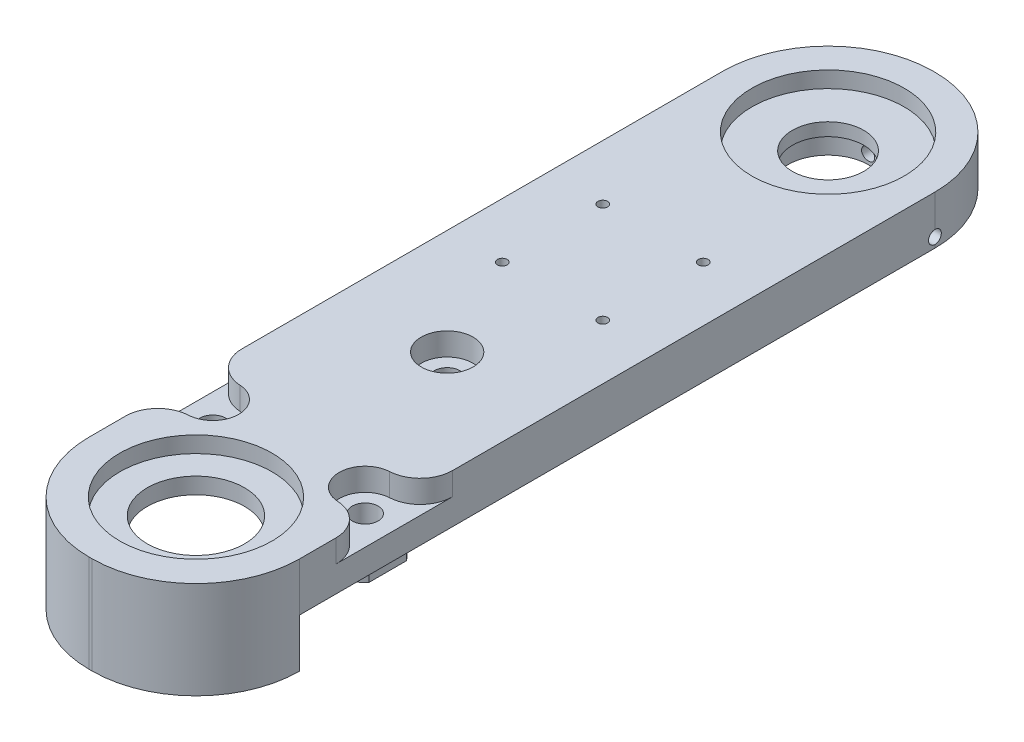
from build123d import *

# Parameters (mm, degrees)
BOSS_EXTRUDE1_DEPTH = 15
SKETCH2_R           = 23.5
CUT_EXTRUDE1_DEPTH  = 5
SKETCH3_R           = 11
CUT_EXTRUDE2_DEPTH  = 135.373546504
SKETCH17_R          = 23.5
CUT_EXTRUDE10_DEPTH = 5
SKETCH18_R          = 15
CUT_EXTRUDE11_DEPTH = 135.373546504
CUT_EXTRUDE12_START = -5
SKETCH19_R          = 23.5
CUT_EXTRUDE12_DEPTH = 5
CUT_EXTRUDE13_DEPTH = 10
SKETCH21_R          = 1.5
CUT_EXTRUDE14_DEPTH = 135.373546504
SKETCH22_R          = 8
CUT_EXTRUDE15_DEPTH = 4
SKETCH23_R          = 4
BOSS_EXTRUDE6_DEPTH = 4
SKETCH24_R          = 4
CUT_EXTRUDE16_DEPTH = 135.837865602
BOSS_EXTRUDE8_START = 15
BOSS_EXTRUDE8_DEPTH = 15
SKETCH28_R          = 8
CUT_EXTRUDE17_DEPTH = 7
FILLET1_R           = 10
SKETCH29_R          = 12.5
CUT_EXTRUDE18_DEPTH = 6
SKETCH30_R          = 2
CUT_EXTRUDE19_DEPTH = 25
SKETCH32_R          = 2
CUT_EXTRUDE20_DEPTH = 25


with BuildPart() as part:
    # Sketch1 → Boss-Extrude1 (new body)
    with BuildSketch(Plane(origin=(0, 0, 0), x_dir=(1, 0, 0), z_dir=(0, 1, 0))):
        with BuildLine():
            Line((0, 130), (0.5, 130))
            ThreePointArc((0.5, 130), (23.127416998, 120.627416998), (32.5, 98))
            Line((32.5, 98), (32.5, -98))
            ThreePointArc((32.5, -98), (23.127416998, -120.627416998), (0.5, -130))
            Line((0.5, -130), (-0.5, -130))
            ThreePointArc((-0.5, -130), (-23.127416998, -120.627416998), (-32.5, -98))
            Line((-32.5, -98), (-32.5, 97.5))
            ThreePointArc((-32.5, 97.5), (-22.980970389, 120.480970389), (0, 130))
        make_face()
    extrude(amount=BOSS_EXTRUDE1_DEPTH)

    # Sketch2 → Cut-Extrude1 (cut)
    with BuildSketch(Plane(origin=(0, 15, 0), x_dir=(1, 0, 0), z_dir=(0, 1, 0))):
        with Locations(Location((0, 97.5, 0), (0, 0, 270))):
            Circle(SKETCH2_R)
    extrude(amount=-CUT_EXTRUDE1_DEPTH, mode=Mode.SUBTRACT)

    # Sketch3 → Cut-Extrude2 (cut, through all)
    with BuildSketch(Plane(origin=(0, 10, 0), x_dir=(1, 0, 0), z_dir=(0, 1, 0))):
        with Locations(Location((0, 97.5, 0), (0, 0, 270))):
            Circle(SKETCH3_R)
    extrude(amount=-CUT_EXTRUDE2_DEPTH, mode=Mode.SUBTRACT)

    # Sketch17 → Cut-Extrude10 (cut)
    with BuildSketch(Plane.XZ):
        with Locations(Location((0, 97.5, 0), (0, 0, 270))):
            Circle(SKETCH17_R)
    extrude(amount=-CUT_EXTRUDE10_DEPTH, mode=Mode.SUBTRACT)

    # Sketch18 → Cut-Extrude11 (cut, through all)
    with BuildSketch(Plane.XZ.offset(-5)):
        with Locations(Location((0, 97.5, 0), (0, 0, 270))):
            Circle(SKETCH18_R)
    extrude(amount=-CUT_EXTRUDE11_DEPTH, mode=Mode.SUBTRACT)

    # Sketch19 → Cut-Extrude12 (cut)
    with BuildSketch(Plane(origin=(0, 15, 0), x_dir=(1, 0, 0), z_dir=(0, 1, 0)).offset(CUT_EXTRUDE12_START)):
        with Locations(Location((0, -97.5, 0), (0, 0, 90))):
            Circle(SKETCH19_R)
    extrude(amount=CUT_EXTRUDE12_DEPTH, mode=Mode.SUBTRACT)

    # Sketch20 → Cut-Extrude13 (cut)
    with BuildSketch(Plane.XZ):
        with BuildLine():
            Line((-20, 0), (20, 0))
            ThreePointArc((20, 0), (27.071067812, -2.928932188), (30, -10))
            Line((30, -10), (30, -60))
            ThreePointArc((30, -60), (27.071067812, -67.071067812), (20, -70))
            Line((20, -70), (-20, -70))
            ThreePointArc((-20, -70), (-27.071067812, -67.071067812), (-30, -60))
            Line((-30, -60), (-30, -10))
            ThreePointArc((-30, -10), (-27.071067812, -2.928932188), (-20, 0))
        make_face()
    extrude(amount=-CUT_EXTRUDE13_DEPTH, mode=Mode.SUBTRACT)

    # Sketch21 → Cut-Extrude14 (cut, through all)
    with BuildSketch(Plane.XZ.offset(-10)):
        with Locations(Location((-15.5, -12.5, 0), (0, 0, 270))):
            Circle(SKETCH21_R)
        with Locations(Location((15.5, -12.5, 0), (0, 0, 270))):
            Circle(SKETCH21_R)
        with Locations(Location((-15.5, -43.5, 0), (0, 0, 270))):
            Circle(SKETCH21_R)
        with Locations(Location((15.5, -43.5, 0), (0, 0, 270))):
            Circle(SKETCH21_R)
    extrude(amount=-CUT_EXTRUDE14_DEPTH, mode=Mode.SUBTRACT)

    # Sketch22 → Cut-Extrude15 (cut)
    with BuildSketch(Plane.XZ):
        with Locations(Location((0, 48.75, 0), (0, 0, 270))):
            Circle(SKETCH22_R)
    extrude(amount=-CUT_EXTRUDE15_DEPTH, mode=Mode.SUBTRACT)

    # Sketch23 → Boss-Extrude6 (add)
    # profile 1 of 2: a face of its own
    with BuildSketch(Plane.XZ):
        with BuildLine():
            Line((-30.5, 74.616516124), (-30.5, 62.993052049))
            ThreePointArc((-30.5, 62.993052049), (-14.401855723, 68.804784086), (-30.5, 74.616516124))
        make_face()
        with Locations(Location((-23.5, 68.804784086, 0), (0, 0, 270))):
            Circle(SKETCH23_R, mode=Mode.SUBTRACT)
    # profile 2 of 2: a face of its own
    with BuildSketch(Plane.XZ):
        with BuildLine():
            Line((30.5, 74.616516124), (30.5, 62.993052049))
            ThreePointArc((30.5, 62.993052049), (14.401855723, 68.804784086), (30.5, 74.616516124))
        make_face()
        with Locations(Location((23.5, 68.804784086, 0), (0, 0, 90))):
            Circle(SKETCH23_R, mode=Mode.SUBTRACT)
    extrude(amount=BOSS_EXTRUDE6_DEPTH)

    # Sketch24 → Cut-Extrude16 (cut, through all)
    with BuildSketch(Plane.XZ):
        with Locations(Location((0, 20, 0), (0, 0, 270))):
            Circle(SKETCH24_R)
        with Locations(Location((-23.5, 68.804784086, 0), (0, 0, 270))):
            Circle(SKETCH24_R)
        with Locations(Location((23.5, 68.804784086, 0), (0, 0, 90))):
            Circle(SKETCH24_R)
    extrude(amount=-CUT_EXTRUDE16_DEPTH, mode=Mode.SUBTRACT)

    # Sketch27 → Boss-Extrude8 (add)
    with BuildSketch(Plane.XZ.offset(BOSS_EXTRUDE8_START)):
        with BuildLine():
            Line((-0.5, 128), (0.5, 128))
            ThreePointArc((0.5, 128), (21.713203436, 119.213203436), (30.5, 98))
            Line((30.5, 98), (32.5, 98))
            ThreePointArc((32.5, 98), (23.127416998, 120.627416998), (0.5, 130))
            Line((0.5, 130), (-0.5, 130))
            ThreePointArc((-0.5, 130), (-23.127416998, 120.627416998), (-32.5, 98))
            Line((-32.5, 98), (-30.5, 98))
            ThreePointArc((-30.5, 98), (-21.713203436, 119.213203436), (-0.5, 128))
        make_face()
    extrude(amount=-BOSS_EXTRUDE8_DEPTH)

    # Sketch28 → Cut-Extrude17 (cut)
    with BuildSketch(Plane(origin=(0, 15, 0), x_dir=(1, 0, 0), z_dir=(0, 1, 0))):
        with Locations(Location((0, -20, 0), (0, 0, 270))):
            Circle(SKETCH28_R)
        with BuildLine():
            Line((-23.5, -60.804784086), (-32.5, -60.804784086))
            Line((-32.5, -60.804784086), (-32.5, -76.804784086))
            Line((-32.5, -76.804784086), (-23.5, -76.804784086))
            ThreePointArc((-23.5, -76.804784086), (-15.5, -68.804784086), (-23.5, -60.804784086))
        make_face()
        with BuildLine():
            Line((32.5, -60.804784086), (32.5, -76.804784086))
            Line((32.5, -76.804784086), (23.5, -76.804784086))
            ThreePointArc((23.5, -76.804784086), (15.5, -68.804784086), (23.5, -60.804784086))
            Line((23.5, -60.804784086), (32.5, -60.804784086))
        make_face()
    extrude(amount=-CUT_EXTRUDE17_DEPTH, mode=Mode.SUBTRACT)

    # Fillet1
    # the kernel refuses this fillet: 10 mm, written as the material it takes off along each edge
    with BuildSketch(Plane(origin=(32.5, 39.930501889, 76.804784086), x_dir=(0, 0, 1), z_dir=(0, -1, 0)), Plane(origin=(-32.5, 39.930501889, 60.804784086), x_dir=(0, 0, -1), z_dir=(0, -1, 0))) as fillet1_piece_1:
        with BuildLine():
            CenterArc((9.972200756, 10), FILLET1_R, 183.184738537, 86.815261463)
            Line((-0.01235522, 9.444444444), (-1.010810817, 9.388888889))
            ThreePointArc((-1.010810817, 9.388888889), (-1, 9), (-1, 0))
            Line((-1, 0), (0, -1))
            Line((0, -1), (9.972200756, -1))
            Line((9.972200756, -1), (9.972200756, 0))
        make_face()
    extrude(amount=31.930501889, mode=Mode.SUBTRACT)
    with BuildSketch(Plane(origin=(32.5, 39.930501889, 60.804784086), x_dir=(0, 0, -1), z_dir=(0, -1, 0)), Plane(origin=(-32.5, 39.930501889, 76.804784086), x_dir=(0, 0, 1), z_dir=(0, -1, 0))) as fillet1_piece_2:
        with BuildLine():
            CenterArc((9.972200756, -10), FILLET1_R, 90, 86.815261463)
            Line((-0.01235522, -9.444444444), (-1.010810817, -9.388888889))
            ThreePointArc((-1.010810817, -9.388888889), (-1, -9), (-1, 0))
            Line((-1, 0), (0, 1))
            Line((0, 1), (9.972200756, 1))
            Line((9.972200756, 1), (9.972200756, 0))
        make_face()
    extrude(amount=31.930501889, mode=Mode.SUBTRACT)

    # Sketch29 → Cut-Extrude18 (cut)
    with BuildSketch(Plane.XZ):
        with Locations(Location((0, -97.5, 0), (0, 0, 270))):
            Circle(SKETCH29_R)
    extrude(amount=-CUT_EXTRUDE18_DEPTH, mode=Mode.SUBTRACT)

    # Sketch30 → Cut-Extrude19 (cut)
    with BuildSketch(Plane(origin=(0, 0, -130), x_dir=(-1, 0, 0), z_dir=(0, 0, -1))):
        with Locations(Location((0, 3, 0), (0, 0, 270))):
            Circle(SKETCH30_R)
    extrude(amount=-CUT_EXTRUDE19_DEPTH, mode=Mode.SUBTRACT)

    # Sketch32 → Cut-Extrude20 (cut)
    with BuildSketch(Plane(origin=(32.5, 0, 0), x_dir=(0, 0, -1), z_dir=(1, 0, 0))):
        with Locations((98, 3)):
            Circle(SKETCH32_R)
    extrude(amount=-CUT_EXTRUDE20_DEPTH, mode=Mode.SUBTRACT)


solid = part.part
